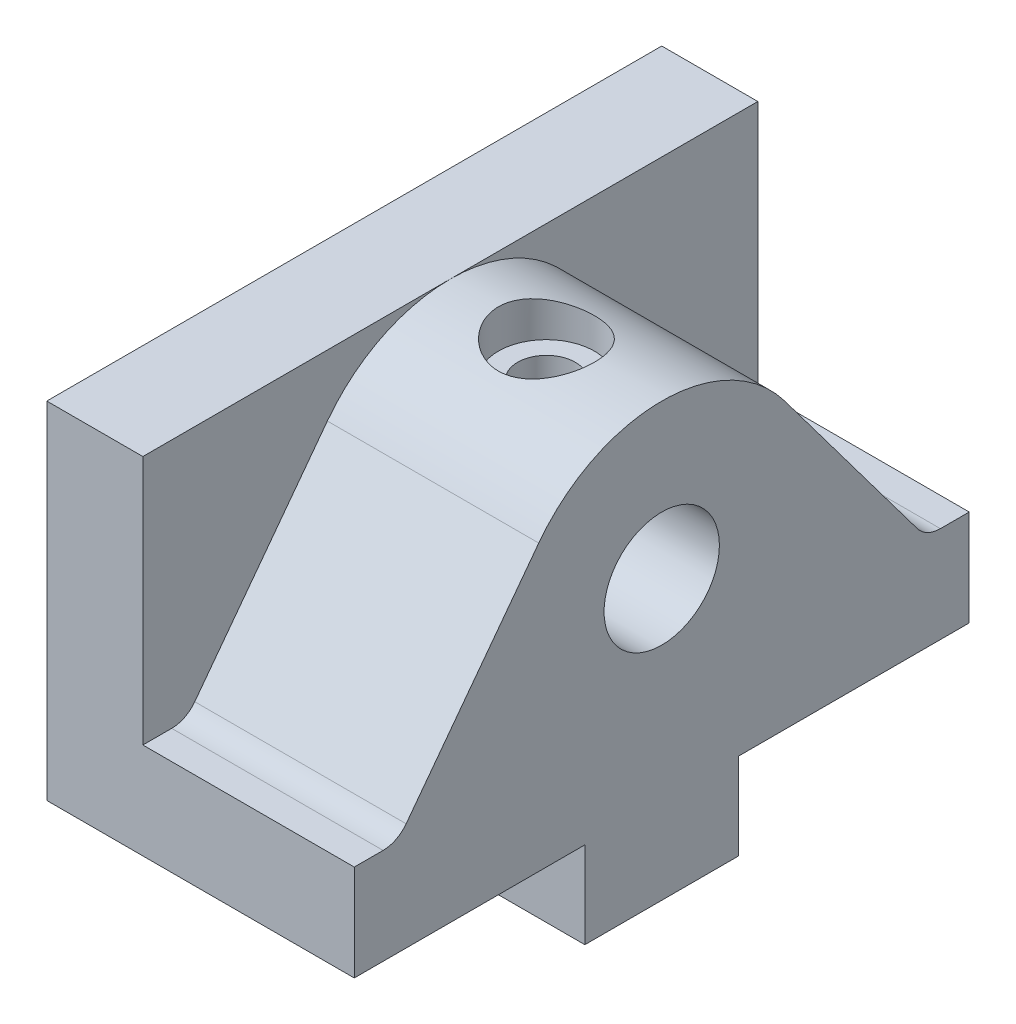
from build123d import *

# Parameters (mm, degrees)
BOSS_EXTRUDE1_DEPTH = 10
BOSS_EXTRUDE2_DEPTH = 22
SKETCH3_R           = 6
CUT_EXTRUDE1_DEPTH  = 24
LPATTERN1_COUNT     = 2
LPATTERN1_PITCH     = 16
FILLET1_R           = 3
FILLET2_R           = 3


# Read off the part's stored shape, not the designer's step: CBORE for M5 Hex Head Bolt1
with BuildPart() as part:
    # Sketch1 → Boss-Extrude1 (new body)
    with BuildSketch(Plane(origin=(0, 0, 0), x_dir=(0, 0, -1), z_dir=(1, 0, 0))):
        Polygon((-32, 45), (32, 45), (32, 9), (8, 9), (8, 0), (-8, 0), (-8, 9), (-32, 9), align=None)
    extrude(amount=BOSS_EXTRUDE1_DEPTH)

    # Sketch2 → Boss-Extrude2 (add)
    with BuildSketch(Plane(origin=(10, 0, 0), x_dir=(0, 0, -1), z_dir=(1, 0, 0))):
        with BuildLine():
            Line((0, 45), (0, 0))
            Line((0, 0), (8, 0))
            Line((8, 0), (8, 9))
            Line((8, 9), (32, 9))
            Line((32, 9), (32, 19))
            Line((32, 19), (27.5, 19))
            Line((27.5, 19), (12.8, 38.6))
            ThreePointArc((12.8, 38.6), (7.155417528, 43.310835056), (0, 45))
        make_face()
        with BuildLine():
            Line((-32, 9), (-8, 9))
            Line((-8, 9), (-8, 0))
            Line((-8, 0), (0, 0))
            Line((0, 0), (0, 45))
            ThreePointArc((0, 45), (-7.155417528, 43.310835056), (-12.8, 38.6))
            Line((-12.8, 38.6), (-27.5, 19))
            Line((-27.5, 19), (-32, 19))
            Line((-32, 19), (-32, 9))
        make_face()
    extrude(amount=BOSS_EXTRUDE2_DEPTH)

    # Sketch3 → Cut-Extrude1 (cut)
    with BuildSketch(Plane(origin=(32, 0, 0), x_dir=(0, 0, -1), z_dir=(1, 0, 0))):
        with Locations((0, 29)):
            Circle(SKETCH3_R)
    extrude(amount=-CUT_EXTRUDE1_DEPTH, mode=Mode.SUBTRACT)

    # CBORE for M5 Hex Head Bolt1 outline → CBORE for M5 Hex Head Bolt1 (revolve, cut)
    with BuildSketch(Plane(origin=(20, 0, 0), x_dir=(1, 0, 0), z_dir=(0, 0, 1))):
        Polygon((0, 34.195854076), (3, 34.195854076), (3, 41), (5, 41), (5, 45.000103319), (0, 45.000103319), align=None)
    revolve(axis=Axis((20, 0, 0), (0, 1, 0)), mode=Mode.SUBTRACT)

    # Sketch7 → Tap Drill for M2.2 Helicoil1 (revolve, cut)
    with BuildSketch(Plane(origin=(24, 0, 0), x_dir=(0, 0, -1), z_dir=(1, 0, 0))):
        Polygon((0, 0), (0, 16.66395281), (1.15, 16), (1.15, 0), align=None)
    tap_drill_for_m2_2_helicoil1 = revolve(axis=Axis((24, -6.35, 0), (0, 1, 0)), mode=Mode.SUBTRACT)

    # LPattern1: Tap Drill for M2.2 Helicoil1 ×2
    with Locations(*[(-i * LPATTERN1_PITCH, 0, 0) for i in range(1, LPATTERN1_COUNT)]):
        add(tap_drill_for_m2_2_helicoil1, mode=Mode.SUBTRACT)

    # Fillet1
    fillet1_edges = [part.edges().sort_by_distance(p)[0] for p in [
        (21, 19, 27.5),
    ]]
    fillet(fillet1_edges, radius=FILLET1_R)

    # Fillet2
    fillet2_edges = [part.edges().sort_by_distance(p)[0] for p in [
        (21, 19, -27.5),
    ]]
    fillet(fillet2_edges, radius=FILLET2_R)


solid = part.part
